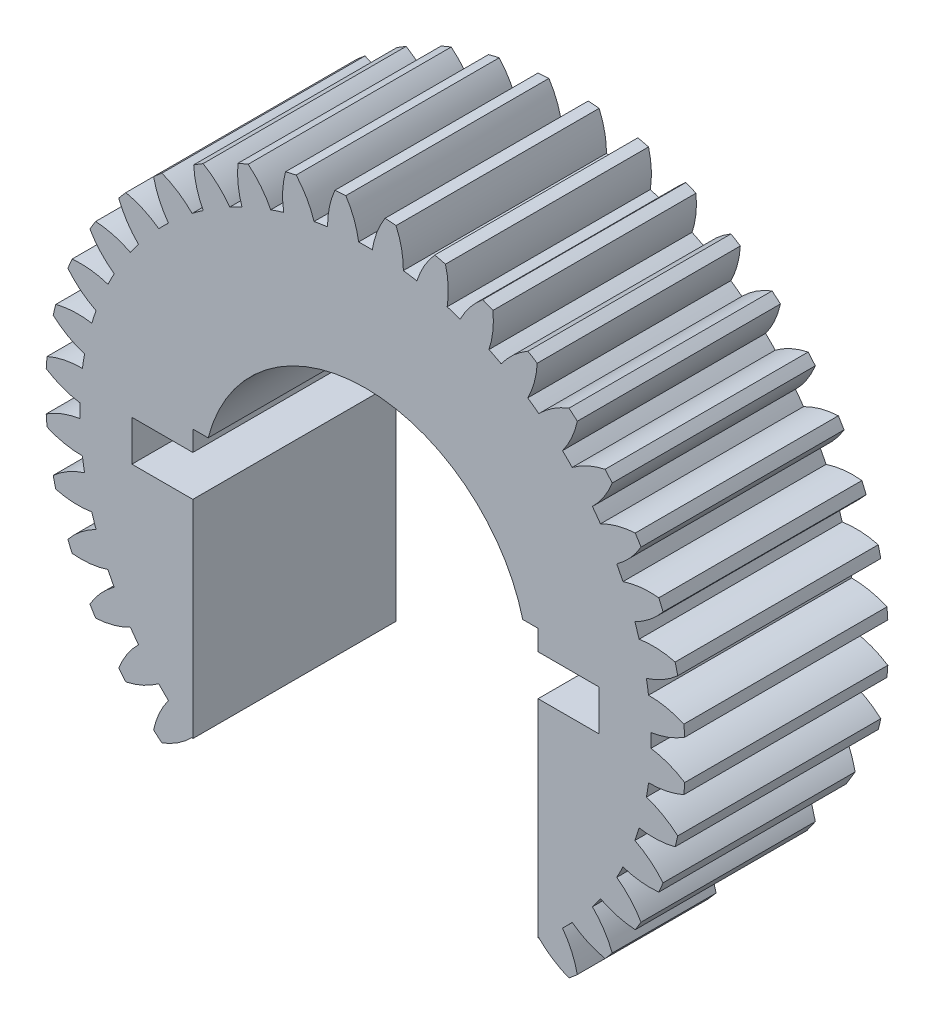
from build123d import *

# Parameters (mm, degrees)
SKETCH_9_R               = 15.75
EXTRUDE_2_DEPTH          = 5
PATTERN_CIRCULAR_1_COUNT = 40
CUT_EXTRUDE_1_DEPTH      = 25.377429848
SKETCH_15_R              = 14
CUT_EXTRUDE_2_DEPTH      = 20
SKETCH_16_R              = 17
CUT_EXTRUDE_3_DEPTH      = 10


with BuildPart() as part:
    # Эскиз9 → Бобышка-Вытянуть2 (new, symmetric)
    with BuildSketch(Plane.XY):
        Circle(SKETCH_9_R)
    extrude(amount=EXTRUDE_2_DEPTH, both=True)

    # Эскиз12 for Вырез-По сечениям2 → Вырез-По сечениям2 section 0
    with BuildSketch(Plane.XY.offset(5)):
        with BuildLine():
            # circular arc as an exact rational Bezier (weights 1, cos(half-angle), 1)
            Bezier((-1.322257739, 16.196114796), (-0.52098101, 15.269555642), (-0.337135547, 14.058458161), weights=[1, 0.960727841, 1])
            Bezier((-0.337135547, 14.058458161), (0, 14.066543001), (0.337135547, 14.058458161), weights=[1, 0.99971258, 1])
            Bezier((0.337135547, 14.058458161), (0.52098101, 15.269555642), (1.322257739, 16.196114796), weights=[1, 0.960727841, 1])
            Bezier((1.322257739, 16.196114796), (0, 16.304064483), (-1.322257739, 16.196114796), weights=[1, 0.996683987, 1])
        make_face()
    # Эскиз10 for Вырез-По сечениям2 → Вырез-По сечениям2 section 1
    with BuildSketch(Plane.XY):
        with BuildLine():
            Bezier((-1.322257739, 16.196114796), (-0.52098101, 15.269555642), (-0.337135547, 14.058458161), weights=[1, 0.960727841, 1])
            Bezier((-0.337135547, 14.058458161), (0, 14.066543001), (0.337135547, 14.058458161), weights=[1, 0.99971258, 1])
            Bezier((0.337135547, 14.058458161), (0.52098101, 15.269555642), (1.322257739, 16.196114796), weights=[1, 0.960727841, 1])
            Bezier((1.322257739, 16.196114796), (0, 16.304064483), (-1.322257739, 16.196114796), weights=[1, 0.996683987, 1])
        make_face()
    # Эскиз13 for Вырез-По сечениям2 → Вырез-По сечениям2 section 2
    with BuildSketch(Plane.XY.offset(-5)):
        with BuildLine():
            Bezier((-1.322257739, 16.196114796), (-0.52098101, 15.269555642), (-0.337135547, 14.058458161), weights=[1, 0.960727841, 1])
            Bezier((-0.337135547, 14.058458161), (0, 14.066543001), (0.337135547, 14.058458161), weights=[1, 0.99971258, 1])
            Bezier((0.337135547, 14.058458161), (0.52098101, 15.269555642), (1.322257739, 16.196114796), weights=[1, 0.960727841, 1])
            Bezier((1.322257739, 16.196114796), (0, 16.304064483), (-1.322257739, 16.196114796), weights=[1, 0.996683987, 1])
        make_face()
    loft_2 = loft(mode=Mode.SUBTRACT)

    # Круговой массив1: Вырез-По сечениям2 ×40 about axis
    pattern_circular_1_axis = Axis((0, 0, 5), (0, 0, -1))
    for i in range(1, PATTERN_CIRCULAR_1_COUNT):
        add(loft_2.rotate(pattern_circular_1_axis, i * 360 / PATTERN_CIRCULAR_1_COUNT), mode=Mode.SUBTRACT)

    # Эскиз14 → Вырез-Вытянуть1 (cut, through all)
    with BuildSketch(Plane(origin=(0, 0, -5), x_dir=(-1, 0, 0), z_dir=(0, 0, -1))):
        with BuildLine():
            Line((-8.5, 1), (-11.5, 1))
            Line((-11.5, 1), (-11.5, -1))
            Line((-11.5, -1), (-8.5, -1))
            Line((-8.5, -1), (-8.5, -18))
            Line((-8.5, -18), (8.5, -18))
            Line((8.5, -18), (8.5, -1))
            Line((8.5, -1), (11.5, -1))
            Line((11.5, -1), (11.5, 1))
            Line((11.5, 1), (8.5, 1))
            Line((8.5, 1), (8.5, 2))
            Line((8.5, 2), (7.745966692, 2))
            ThreePointArc((7.745966692, 2), (0, 8), (-7.745966692, 2))
            Line((-7.745966692, 2), (-8.5, 2))
            Line((-8.5, 2), (-8.5, 1))
        make_face()
    extrude(amount=-CUT_EXTRUDE_1_DEPTH, mode=Mode.SUBTRACT)

    # Эскиз15 → Вырез-Вытянуть2 (cut)
    with BuildSketch(Plane(origin=(25.5, 0, 0), x_dir=(0, 0, -1), z_dir=(1, 0, 0))):
        with Locations((17, -12)):
            Circle(SKETCH_15_R)
    extrude(amount=-CUT_EXTRUDE_2_DEPTH, mode=Mode.SUBTRACT)

    # Эскиз16 → Вырез-Вытянуть3 (cut)
    with BuildSketch(Plane(origin=(12.5, 0, 0), x_dir=(0, 0, -1), z_dir=(1, 0, 0))):
        with Locations((17, -12)):
            Circle(SKETCH_16_R)
    extrude(amount=-CUT_EXTRUDE_3_DEPTH, mode=Mode.SUBTRACT)


solid = part.part
